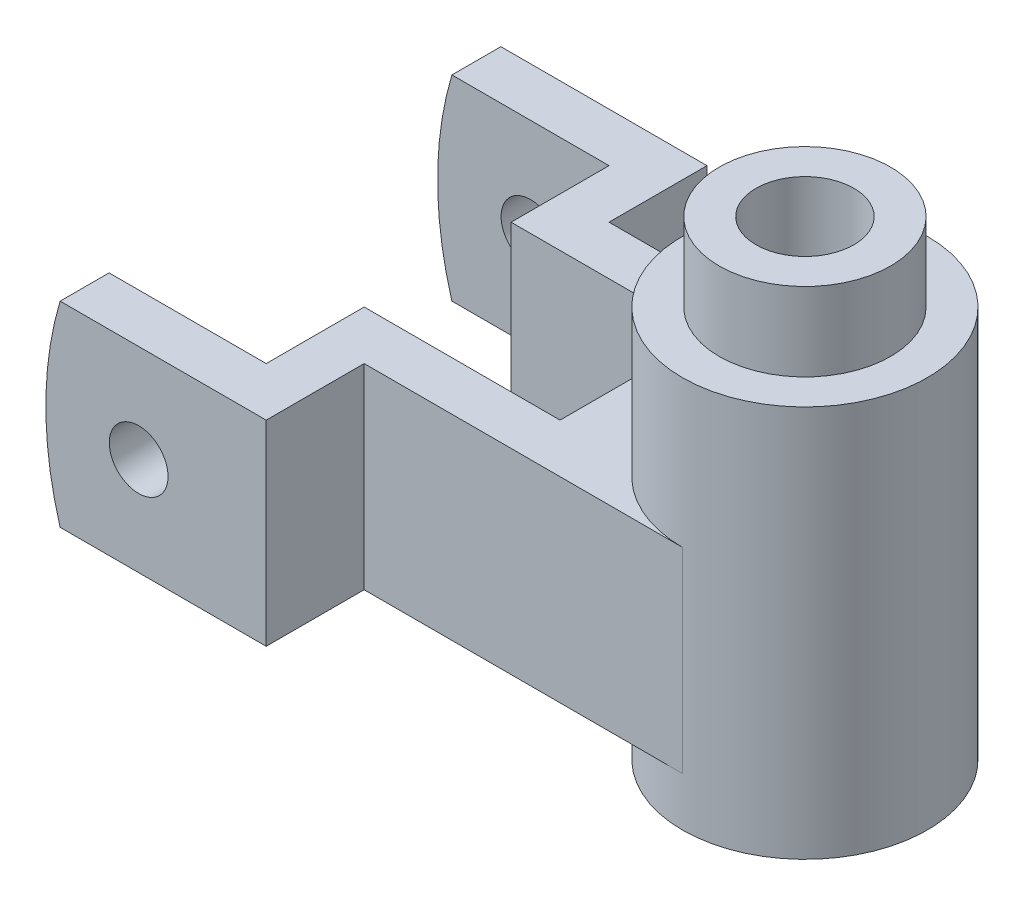
from build123d import *

# Parameters (mm, degrees)
BOSS_EXTRUDE1_DEPTH      = 40
CUT_EXTRUDE2_DEPTH       = 90
CUT_EXTRUDE4_DEPTH       = 151
CUT_EXTRUDE4_DEPTH_BACK  = 151
SKETCH3_R                = 6
BOSS_EXTRUDE2_DEPTH      = 30
BOSS_EXTRUDE2_DEPTH_BACK = 50
F_3DSKETCH1_R            = 25
SKETCH5_R                = 17.5
SKETCH5_R_2              = 10
BOSS_EXTRUDE3_DEPTH      = 86


with BuildPart() as part:
    # Sketch1 → Boss-Extrude1 (new body)
    with BuildSketch(Plane(origin=(0, 0, 0), x_dir=(1, 0, 0), z_dir=(0, 1, 0))):
        Polygon((-56.273517373, 36.016865909), (-56.273517373, 26.016865909), (-21.273517373, 26.016865909), (-21.273517373, 6.016865909), (18.726482627, 6.016865909), (18.726482627, -23.983134091), (-21.273517373, -23.983134091), (-21.273517373, -43.983134091), (-56.273517373, -43.983134091), (-56.273517373, -53.983134091), (-11.273517373, -53.983134091), (-11.273517373, -33.983134091), (53.726482627, -33.983134091), (53.726482627, 16.016865909), (-11.273517373, 16.016865909), (-11.273517373, 36.016865909), align=None)
    extrude(amount=BOSS_EXTRUDE1_DEPTH)

    # Sketch2 → Cut-Extrude2 (cut)
    with BuildSketch(Plane.XY.offset(53.983134091)):
        with BuildLine():
            ThreePointArc((-56.273517373, 20), (-55.540185955, 30.10587075), (-53.355556698, 40))
            Line((-53.355556698, 40), (-56.273517373, 40))
            Line((-56.273517373, 40), (-56.273517373, 20))
        make_face()
        with BuildLine():
            ThreePointArc((-53.355556698, 0), (-55.540185955, 9.89412925), (-56.273517373, 20))
            Line((-56.273517373, 20), (-56.273517373, 0))
            Line((-56.273517373, 0), (-53.355556698, 0))
        make_face()
    extrude(amount=-CUT_EXTRUDE2_DEPTH, mode=Mode.SUBTRACT)

    # Sketch3 → Cut-Extrude4 (cut, two sides: drawn at the far end of the back side and taken through both)
    with BuildSketch(Plane.XY.offset(-26.016865909).offset(-CUT_EXTRUDE4_DEPTH_BACK)):
        with Locations((-37.314537036, 20)):
            Circle(SKETCH3_R)
    extrude(amount=CUT_EXTRUDE4_DEPTH + CUT_EXTRUDE4_DEPTH_BACK, mode=Mode.SUBTRACT)

    # 3DSketch1 → Boss-Extrude2 (add, two sides: drawn at the far end of the back side and taken through both)
    with BuildSketch(Plane(origin=(53.726482627, 40, 8.983134091), x_dir=(0, 0, 1), z_dir=(0, 1, 0)).offset(-BOSS_EXTRUDE2_DEPTH_BACK)):
        Circle(F_3DSKETCH1_R)
    extrude(amount=BOSS_EXTRUDE2_DEPTH + BOSS_EXTRUDE2_DEPTH_BACK)

    # Sketch5 → Boss-Extrude3 (add)
    with BuildSketch(Plane(origin=(0, 0, 0), x_dir=(1, 0, 0), z_dir=(0, 1, 0))):
        with Locations((53.726482627, -8.983134091)):
            Circle(SKETCH5_R)
        with Locations((53.726482627, -8.983134091)):
            Circle(SKETCH5_R_2, mode=Mode.SUBTRACT)
    extrude(amount=BOSS_EXTRUDE3_DEPTH)


solid = part.part
